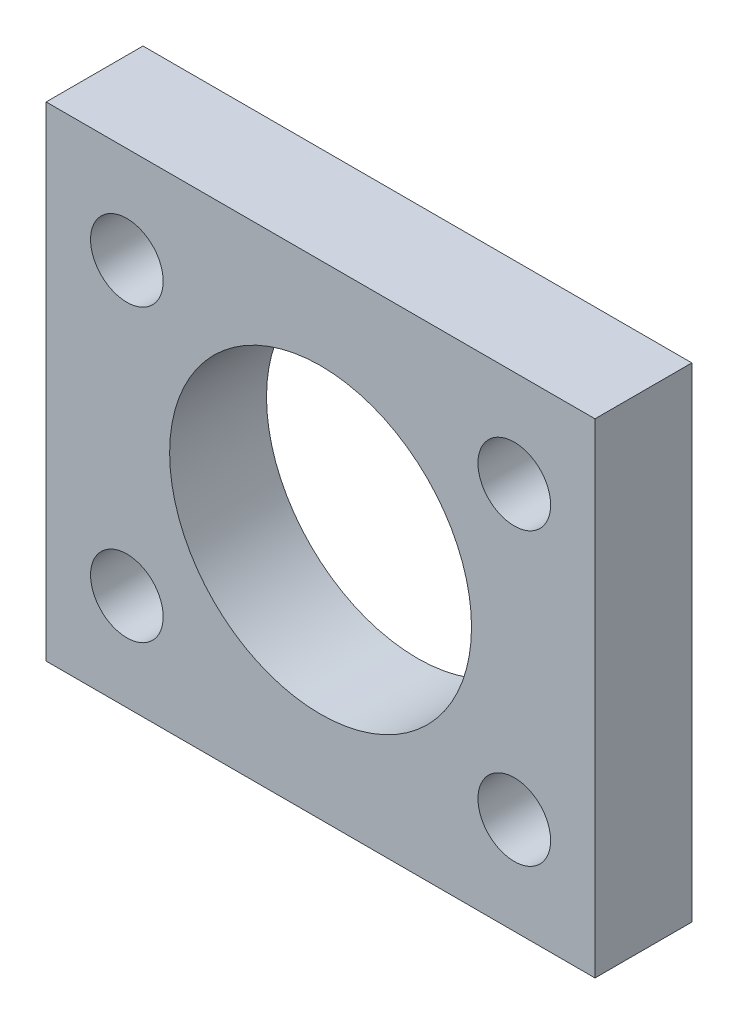
from build123d import *

# Parameters (mm, degrees)
SKETCH2_W           = 34
SKETCH2_H           = 30
BOSS_EXTRUDE1_DEPTH = 6
SKETCH3_R           = 2.25
CUT_EXTRUDE1_DEPTH  = 10
SKETCH4_R           = 9.35
CUT_EXTRUDE2_DEPTH  = 10


with BuildPart() as part:
    # Sketch2 → Boss-Extrude1 (new body)
    with BuildSketch(Plane.XY):
        Rectangle(SKETCH2_W, SKETCH2_H)
    extrude(amount=BOSS_EXTRUDE1_DEPTH)

    # Sketch3 → Cut-Extrude1 (cut)
    with BuildSketch(Plane(origin=(0, 0, 0), x_dir=(-1, 0, 0), z_dir=(0, 0, -1))):
        with Locations((-12, 9)):
            Circle(SKETCH3_R)
        with Locations((12, 9)):
            Circle(SKETCH3_R)
        with Locations((12, -9)):
            Circle(SKETCH3_R)
        with Locations((-12, -9)):
            Circle(SKETCH3_R)
    extrude(amount=-CUT_EXTRUDE1_DEPTH, mode=Mode.SUBTRACT)

    # Sketch4 → Cut-Extrude2 (cut)
    with BuildSketch(Plane(origin=(0, 0, 0), x_dir=(-1, 0, 0), z_dir=(0, 0, -1))):
        Circle(SKETCH4_R)
    extrude(amount=-CUT_EXTRUDE2_DEPTH, mode=Mode.SUBTRACT)


solid = part.part
